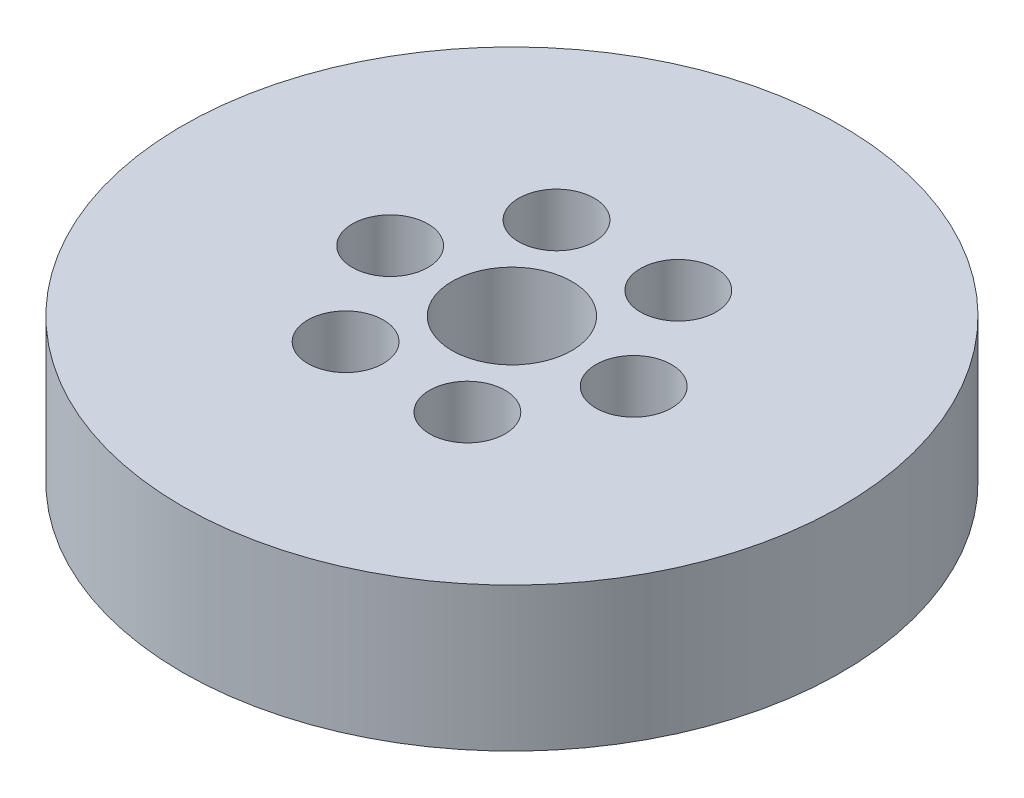
from build123d import *

# Parameters (mm, degrees)
SKETCH1_R           = 55
BOSS_EXTRUDE1_DEPTH = 24
SKETCH2_R           = 10
CUT_EXTRUDE1_DEPTH  = 82.4002457
SKETCH3_R           = 6.3089282
CUT_EXTRUDE2_DEPTH  = 17.672909829
CIRPATTERN1_COUNT   = 6


with BuildPart() as part:
    # Sketch1 → Boss-Extrude1 (new body)
    with BuildSketch(Plane(origin=(0, 0, 0), x_dir=(1, 0, 0), z_dir=(0, 1, 0))):
        Circle(SKETCH1_R)
    extrude(amount=BOSS_EXTRUDE1_DEPTH)

    # Sketch2 → Cut-Extrude1 (cut, through all)
    with BuildSketch(Plane(origin=(0, 0, 0), x_dir=(1, 0, 0), z_dir=(0, 1, 0))):
        Circle(SKETCH2_R)
    extrude(amount=CUT_EXTRUDE1_DEPTH, mode=Mode.SUBTRACT)

    # Sketch3 → Cut-Extrude2 (cut)
    with BuildSketch(Plane(origin=(0, 24, 0), x_dir=(1, 0, 0), z_dir=(0, 1, 0))):
        with Locations((-20.322826391, 0)):
            Circle(SKETCH3_R)
    cut_extrude2 = extrude(amount=-CUT_EXTRUDE2_DEPTH, mode=Mode.SUBTRACT)

    # CirPattern1: Cut-Extrude2 ×6 about axis
    cirpattern1_axis = Axis((0, 0, 0), (0, 1, 0))
    for i in range(1, CIRPATTERN1_COUNT):
        add(cut_extrude2.rotate(cirpattern1_axis, i * 360 / CIRPATTERN1_COUNT), mode=Mode.SUBTRACT)


solid = part.part
